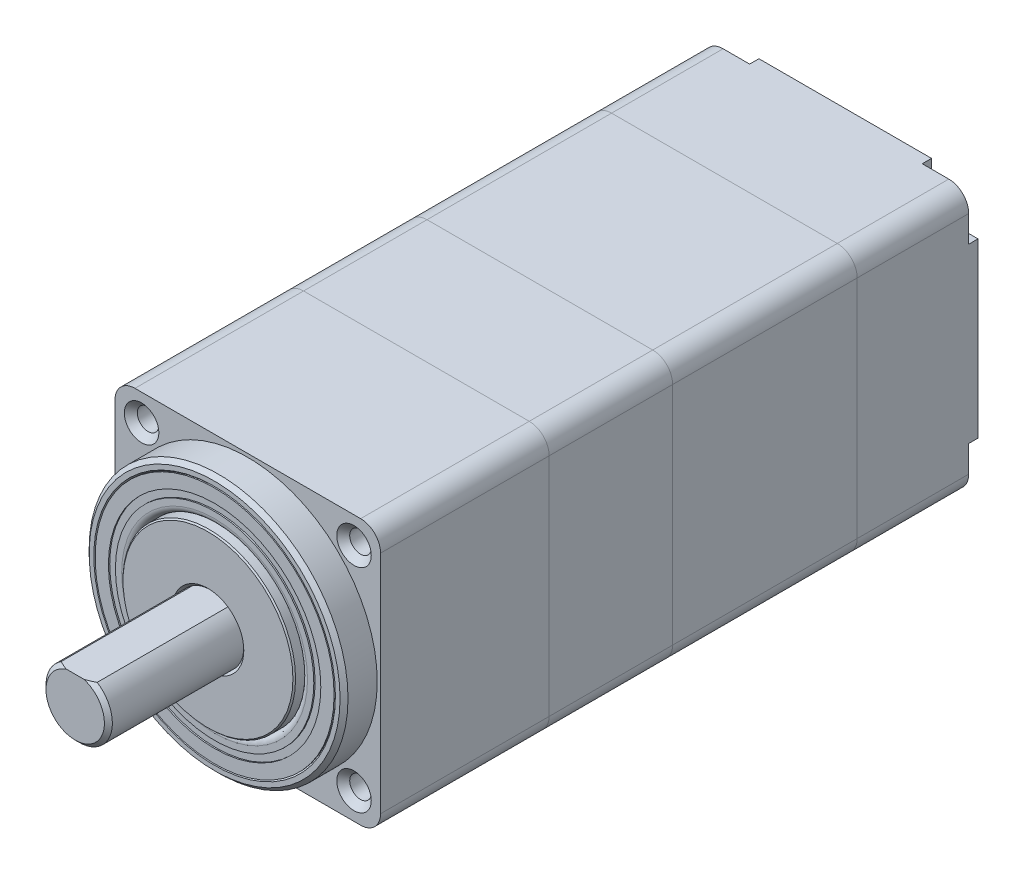
from build123d import *

# Parameters (mm, degrees)
SKETCH_1_W          = 20
SKETCH_1_H          = 20
EXTRUDE_1_DEPTH     = 9.1
CUT_EXTRUDE_1_REACH = 18.817
SKETCH_2_R          = 1
SKETCH_3_W          = 3.5
SKETCH_3_H          = 3.5
CUT_EXTRUDE_2_DEPTH = 0.7
FILLET_1_R          = 1.5
SKETCH_12_R         = 2.5
CUT_EXTRUDE_6_DEPTH = 4
SKETCH_4_W          = 20
SKETCH_4_H          = 20
EXTRUDE_2_DEPTH     = 13.9
SKETCH_5_W          = 20
SKETCH_5_H          = 20
EXTRUDE_3_DEPTH     = 9.3
SKETCH_7_W          = 20
SKETCH_7_H          = 20
EXTRUDE_4_DEPTH     = 12.7
SKETCH_8_R          = 0.8115
CUT_EXTRUDE_4_DEPTH = 12.7
FILLET_2_R          = 1.5
FILLET_3_R          = 1.5
FILLET_4_R          = 1.5
FILLET_5_R          = 1.5
CHAMFER_2_SIZE      = 0.4885
SKETCH_13_R         = 9.75
SKETCH_13_R_2       = 9
EXTRUDE_5_DEPTH     = 2.5
CHAMFER_3_SIZE      = 0.3
CHAMFER_4_SIZE      = 0.1
SKETCH_14_R         = 6.5
SKETCH_14_R_2       = 2.5
EXTRUDE_6_DEPTH     = 3
CHAMFER_5_SIZE      = 0.1
CHAMFER_6_SIZE      = 0.2
SKETCH_15_R         = 9
SKETCH_15_R_2       = 6.5
EXTRUDE_7_DEPTH     = 2.5
FILLET_6_R          = 0.5
SKETCH_16_R         = 8
SKETCH_16_R_2       = 7.4725
CUT_EXTRUDE_7_DEPTH = 0.1
SKETCH_17_R         = 2.5
EXTRUDE_8_DEPTH     = 13
CUT_EXTRUDE_START   = -13
CUT_EXTRUDE_8_DEPTH = 13
CHAMFER_7_SIZE      = 0.3


with BuildPart() as part:
    # 草图1 → 凸台-拉伸1 (new body)
    with BuildSketch(Plane.XY):
        Rectangle(SKETCH_1_W, SKETCH_1_H)
    extrude(amount=EXTRUDE_1_DEPTH)

    # 草图2 → 切除-拉伸1 (cut, up to next)
    with BuildSketch(Plane(origin=(0, 0, 0), x_dir=(-1, 0, 0), z_dir=(0, 0, -1)), mode=Mode.PRIVATE) as cut_extrude_1_sk1:
        with Locations((-8, 8)):
            Circle(SKETCH_2_R)
    cut_extrude_1_tool1 = extrude(cut_extrude_1_sk1.sketch, amount=-CUT_EXTRUDE_1_REACH, mode=Mode.PRIVATE) & part.part
    # 草图2 → 切除-拉伸1 (cut, up to next)
    with BuildSketch(Plane(origin=(0, 0, 0), x_dir=(-1, 0, 0), z_dir=(0, 0, -1)), mode=Mode.PRIVATE) as cut_extrude_1_sk2:
        with Locations((8, 8)):
            Circle(SKETCH_2_R)
    cut_extrude_1_tool2 = extrude(cut_extrude_1_sk2.sketch, amount=-CUT_EXTRUDE_1_REACH, mode=Mode.PRIVATE) & part.part
    # 草图2 → 切除-拉伸1 (cut, up to next)
    with BuildSketch(Plane(origin=(0, 0, 0), x_dir=(-1, 0, 0), z_dir=(0, 0, -1)), mode=Mode.PRIVATE) as cut_extrude_1_sk3:
        with Locations((8, -8)):
            Circle(SKETCH_2_R)
    cut_extrude_1_tool3 = extrude(cut_extrude_1_sk3.sketch, amount=-CUT_EXTRUDE_1_REACH, mode=Mode.PRIVATE) & part.part
    # 草图2 → 切除-拉伸1 (cut, up to next)
    with BuildSketch(Plane(origin=(0, 0, 0), x_dir=(-1, 0, 0), z_dir=(0, 0, -1)), mode=Mode.PRIVATE) as cut_extrude_1_sk4:
        with Locations((-8, -8)):
            Circle(SKETCH_2_R)
    cut_extrude_1_tool4 = extrude(cut_extrude_1_sk4.sketch, amount=-CUT_EXTRUDE_1_REACH, mode=Mode.PRIVATE) & part.part
    add(cut_extrude_1_tool1.solids().sort_by_distance((8, 8, 0))[0], mode=Mode.SUBTRACT)
    add(cut_extrude_1_tool2.solids().sort_by_distance((-8, 8, 0))[0], mode=Mode.SUBTRACT)
    add(cut_extrude_1_tool3.solids().sort_by_distance((-8, -8, 0))[0], mode=Mode.SUBTRACT)
    add(cut_extrude_1_tool4.solids().sort_by_distance((8, -8, 0))[0], mode=Mode.SUBTRACT)

    # 草图3 → 切除-拉伸2 (cut)
    with BuildSketch(Plane(origin=(0, 0, 0), x_dir=(-1, 0, 0), z_dir=(0, 0, -1))):
        with Locations((-8.25, 8.25)):
            Rectangle(SKETCH_3_W, SKETCH_3_H)
        with Locations((8.25, 8.25)):
            Rectangle(SKETCH_3_W, SKETCH_3_H)
        with Locations((8.25, -8.25)):
            Rectangle(SKETCH_3_W, SKETCH_3_H)
        with Locations((-8.25, -8.25)):
            Rectangle(SKETCH_3_W, SKETCH_3_H)
    extrude(amount=-CUT_EXTRUDE_2_DEPTH, mode=Mode.SUBTRACT)

    # 圆角1
    fillet_1_edges = [part.edges().sort_by_distance(p)[0] for p in [
        (6.5, -6.5, 0.35),
        (-6.5, -6.5, 0.35),
        (-6.5, 6.5, 0.35),
        (6.5, 6.5, 0.35),
    ]]
    fillet(fillet_1_edges, radius=FILLET_1_R)

    # 草图12 → 切除-拉伸6 (cut)
    with BuildSketch(Plane(origin=(0, 0, 0), x_dir=(-1, 0, 0), z_dir=(0, 0, -1))):
        Circle(SKETCH_12_R)
    extrude(amount=-CUT_EXTRUDE_6_DEPTH, mode=Mode.SUBTRACT)

    # 圆角5
    fillet_5_edges = [part.edges().sort_by_distance(p)[0] for p in [
        (10, -10, 4.9),
        (-10, -10, 4.9),
        (-10, 10, 4.9),
        (10, 10, 4.9),
    ]]
    fillet(fillet_5_edges, radius=FILLET_5_R)


with BuildPart() as body_2:
    # 草图4 → 凸台-拉伸2 (new body)
    with BuildSketch(Plane.XY.offset(9.1)):
        Rectangle(SKETCH_4_W, SKETCH_4_H)
    extrude(amount=EXTRUDE_2_DEPTH)

    # 圆角4
    fillet_4_edges = [body_2.edges().sort_by_distance(p)[0] for p in [
        (-10, -10, 16.05),
        (-10, 10, 16.05),
        (10, 10, 16.05),
        (10, -10, 16.05),
    ]]
    fillet(fillet_4_edges, radius=FILLET_4_R)


with BuildPart() as body_3:
    # 草图5 → 凸台-拉伸3 (new body)
    with BuildSketch(Plane.XY.offset(23)):
        Rectangle(SKETCH_5_W, SKETCH_5_H)
    extrude(amount=EXTRUDE_3_DEPTH)

    # 圆角3
    fillet_3_edges = [body_3.edges().sort_by_distance(p)[0] for p in [
        (-10, 10, 27.65),
        (10, 10, 27.65),
        (10, -10, 27.65),
        (-10, -10, 27.65),
    ]]
    fillet(fillet_3_edges, radius=FILLET_3_R)


with BuildPart() as body_4:
    # 草图7 → 凸台-拉伸4 (new body)
    with BuildSketch(Plane.XY.offset(32.3)):
        Rectangle(SKETCH_7_W, SKETCH_7_H)
    extrude(amount=EXTRUDE_4_DEPTH)

    # 草图8 → 切除-拉伸4 (cut)
    with BuildSketch(Plane.XY.offset(45)):
        with Locations((-8, 8)):
            Circle(SKETCH_8_R)
        with Locations((8, 8)):
            Circle(SKETCH_8_R)
        with Locations((8, -8)):
            Circle(SKETCH_8_R)
        with Locations((-8, -8)):
            Circle(SKETCH_8_R)
    extrude(amount=-CUT_EXTRUDE_4_DEPTH, mode=Mode.SUBTRACT)

    # 圆角2
    fillet_2_edges = [body_4.edges().sort_by_distance(p)[0] for p in [
        (10, 10, 38.65),
        (10, -10, 38.65),
        (-10, -10, 38.65),
        (-10, 10, 38.65),
    ]]
    fillet(fillet_2_edges, radius=FILLET_2_R)

    # 倒角2
    chamfer_2_edges = [body_4.edges().sort_by_distance(p)[0] for p in [
        (-8.8115, -8, 45),
        (7.1885, -8, 45),
        (7.1885, 8, 45),
        (-8.8115, 8, 45),
    ]]
    chamfer(chamfer_2_edges, length=CHAMFER_2_SIZE)


with BuildPart() as body_5:
    # 草图13 → 凸台-拉伸5 (new body)
    with BuildSketch(Plane.XY.offset(45)):
        Circle(SKETCH_13_R)
        Circle(SKETCH_13_R_2, mode=Mode.SUBTRACT)
    extrude(amount=EXTRUDE_5_DEPTH)

    # 倒角3
    chamfer_3_edges = [body_5.edges().sort_by_distance(p)[0] for p in [
        (-9.75, 0, 47.5),
    ]]
    chamfer(chamfer_3_edges, length=CHAMFER_3_SIZE)

    # 倒角4
    chamfer_4_edges = [body_5.edges().sort_by_distance(p)[0] for p in [
        (-9, 0, 47.5),
    ]]
    chamfer(chamfer_4_edges, length=CHAMFER_4_SIZE)


with BuildPart() as body_6:
    # 草图14 → 凸台-拉伸6 (new body)
    with BuildSketch(Plane.XY.offset(45)):
        Circle(SKETCH_14_R)
        Circle(SKETCH_14_R_2, mode=Mode.SUBTRACT)
    extrude(amount=EXTRUDE_6_DEPTH)

    # 倒角5
    chamfer_5_edges = [body_6.edges().sort_by_distance(p)[0] for p in [
        (-6.5, 0, 48),
    ]]
    chamfer(chamfer_5_edges, length=CHAMFER_5_SIZE)

    # 倒角6
    chamfer_6_edges = [body_6.edges().sort_by_distance(p)[0] for p in [
        (-2.5, 0, 48),
    ]]
    chamfer(chamfer_6_edges, length=CHAMFER_6_SIZE)


with BuildPart() as body_7:
    # 草图15 → 凸台-拉伸7 (new body)
    with BuildSketch(Plane.XY.offset(45)):
        Circle(SKETCH_15_R)
        Circle(SKETCH_15_R_2, mode=Mode.SUBTRACT)
    extrude(amount=EXTRUDE_7_DEPTH)

    # 圆角6
    fillet_6_edges = [body_7.edges().sort_by_distance(p)[0] for p in [
        (-6.5, 0, 47.5),
    ]]
    fillet(fillet_6_edges, radius=FILLET_6_R)

    # 草图16 → 切除-拉伸7 (cut)
    with BuildSketch(Plane.XY.offset(47.5)):
        Circle(SKETCH_16_R)
        Circle(SKETCH_16_R_2, mode=Mode.SUBTRACT)
    extrude(amount=-CUT_EXTRUDE_7_DEPTH, mode=Mode.SUBTRACT)


with BuildPart() as body_8:
    # 草图17 → 凸台-拉伸8 (new body)
    with BuildSketch(Plane.XY.offset(45)):
        with Locations(Location((0, 0, 0), (0, 0, 180))):
            Circle(SKETCH_17_R)
    extrude(amount=EXTRUDE_8_DEPTH)

    # 草图18 → 切除-拉伸8 (cut)
    with BuildSketch(Plane.XY.offset(58).offset(CUT_EXTRUDE_START)):
        with BuildLine():
            Line((-1.356465997, 2.1), (1.356465997, 2.1))
            ThreePointArc((1.356465997, 2.1), (0, 2.5), (-1.356465997, 2.1))
        make_face()
    extrude(amount=CUT_EXTRUDE_8_DEPTH, mode=Mode.SUBTRACT)

    # 倒角7
    chamfer_7_edges = [body_8.edges().sort_by_distance(p)[0] for p in [
        (0, -2.5, 58),
    ]]
    chamfer(chamfer_7_edges, length=CHAMFER_7_SIZE)


solid = Compound([part.part, body_2.part, body_3.part, body_4.part, body_5.part, body_6.part, body_7.part, body_8.part])
